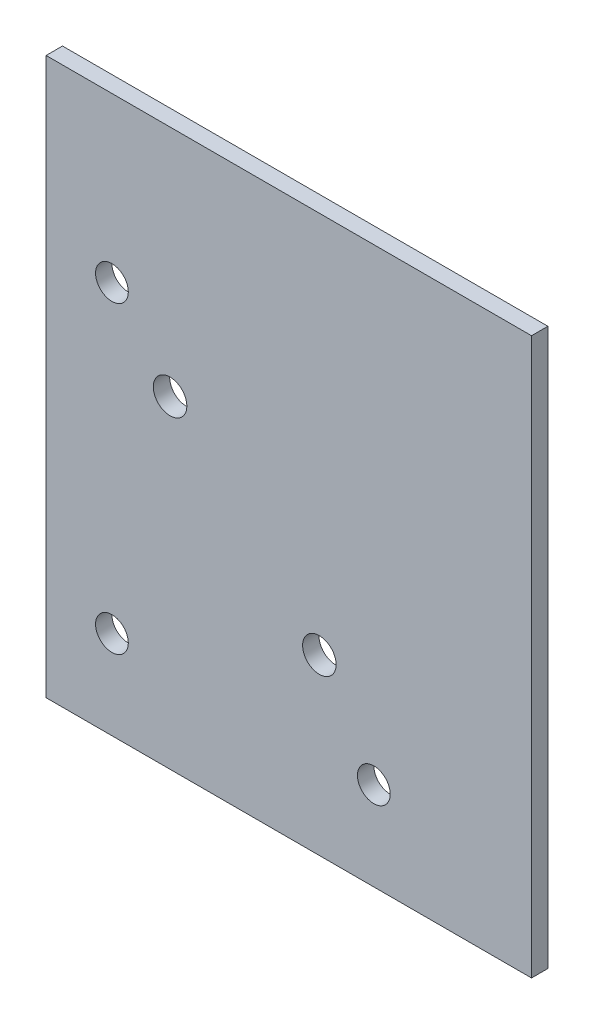
from build123d import *

# Parameters (mm, degrees)
SKETCH1_W           = 94.149921214
SKETCH1_H           = 107.889878539
SKETCH1_R           = 3.175
SKETCH1_R_2         = 3.2512
BOSS_EXTRUDE1_DEPTH = 3.175


with BuildPart() as part:
    # Sketch1 → Boss-Extrude1 (new body)
    with BuildSketch(Plane.XY):
        with Locations((-41.891689505, 154.705348562)):
            Rectangle(SKETCH1_W, SKETCH1_H)
        with Locations((-76.2, 117.928571429)):
            Circle(SKETCH1_R, mode=Mode.SUBTRACT)
        with Locations((-25.4, 117.928571429)):
            Circle(SKETCH1_R, mode=Mode.SUBTRACT)
        with Locations((-76.2, 176.892857143)):
            Circle(SKETCH1_R, mode=Mode.SUBTRACT)
        with Locations((-64.92346069, 163.396667498)):
            Circle(SKETCH1_R_2, mode=Mode.SUBTRACT)
        with Locations((-35.96746069, 134.440667498)):
            Circle(SKETCH1_R_2, mode=Mode.SUBTRACT)
    extrude(amount=BOSS_EXTRUDE1_DEPTH)


solid = part.part
